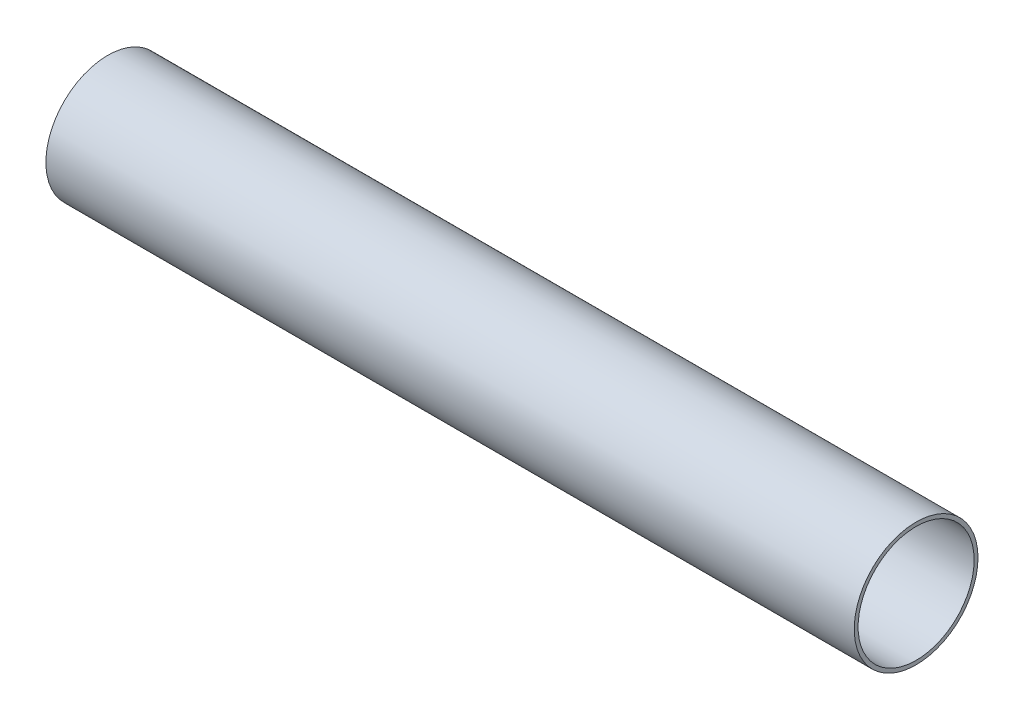
from build123d import *

# Parameters (mm, degrees)
SKETCH1_R           = 25.4
SKETCH1_R_2         = 23.8125
EXTRUDE_THIN1_DEPTH = 165.89375


with BuildPart() as part:
    # Sketch1 → Extrude-Thin1 (new, symmetric)
    with BuildSketch(Plane(origin=(0, 0, 0), x_dir=(0, 0, -1), z_dir=(1, 0, 0))):
        Circle(SKETCH1_R)
        Circle(SKETCH1_R_2, mode=Mode.SUBTRACT)
    extrude(amount=EXTRUDE_THIN1_DEPTH, both=True)


solid = part.part
